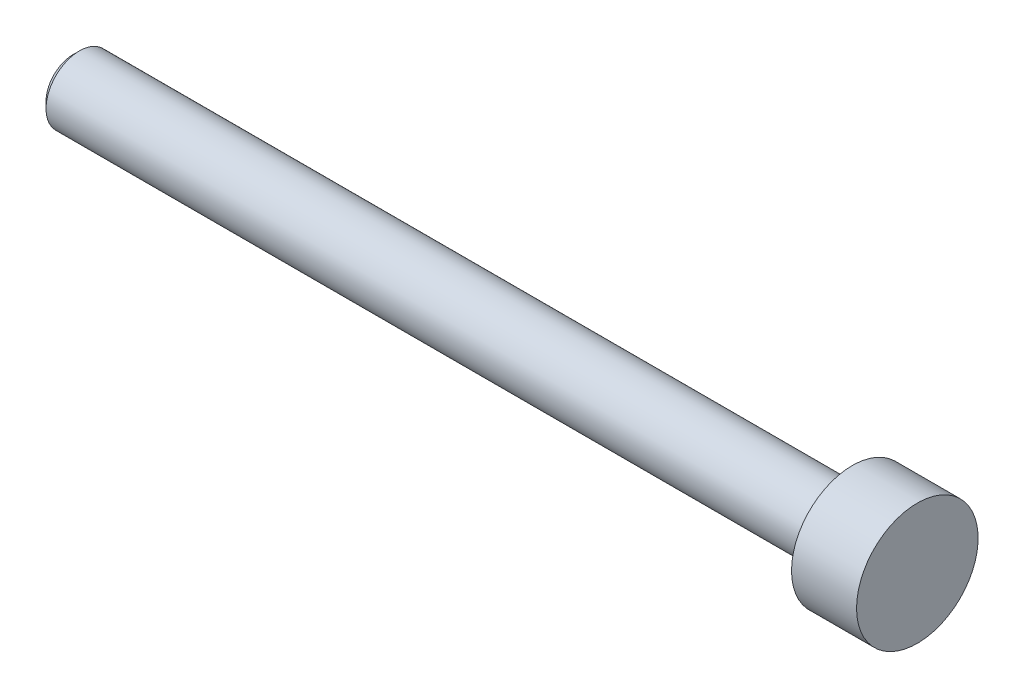
from build123d import *


# Read off the part's stored shape, not the designer's step: M3x0.5 Machine Threads Stud1
with BuildPart() as part:
    # Sketch1 → Revolve1 (revolve)
    with BuildSketch(Plane(origin=(0, 0, 0), x_dir=(-1, 0, 0), z_dir=(0, 1, 0))):
        Polygon((0, 1.524), (0, 0), (-37.921000104, 0), (-37.921000104, 2.7305), (-35.000000104, 2.7305), (-35.000000104, 1.524), align=None)
    revolve(axis=Axis((0, 0, 0), (1, 0, 0)))

    # M3x0.5 Machine Threads Stud1 outline → M3x0.5 Machine Threads Stud1 (revolve, cut)
    with BuildSketch(Plane.YX):
        Polygon((1.524, 35.000000104), (1.5, 35.000000104), (1.5, 0.2805), (1.2195, 0), (1.524, 0), align=None)
    revolve(axis=Axis((0, 0, 0), (1, 0, 0)), mode=Mode.SUBTRACT)


solid = part.part
